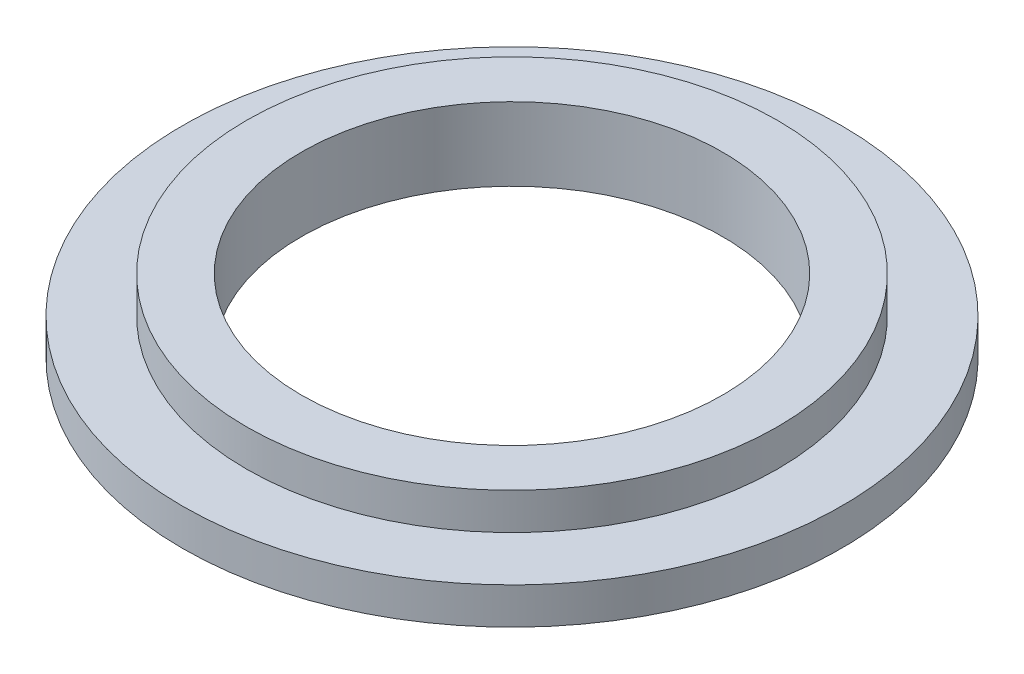
from build123d import *

# Parameters (mm, degrees)
SKETCH1_R               = 18
BOSS_EXTRUDE1_DEPTH     = 2
SKETCH2_R               = 14.5
BOSS_EXTRUDE2_DEPTH     = 2
CUT_EXTRUDE3_DEPTH      = 26.768197453
CUT_EXTRUDE3_DEPTH_BACK = 26.768197453
SKETCH3_R               = 11.5


with BuildPart() as part:
    # Sketch1 → Boss-Extrude1 (new body)
    with BuildSketch(Plane(origin=(0, 0, 0), x_dir=(1, 0, 0), z_dir=(0, 1, 0))):
        Circle(SKETCH1_R)
    extrude(amount=BOSS_EXTRUDE1_DEPTH)

    # Sketch2 → Boss-Extrude2 (add)
    with BuildSketch(Plane(origin=(0, 2, 0), x_dir=(1, 0, 0), z_dir=(0, 1, 0))):
        Circle(SKETCH2_R)
    extrude(amount=BOSS_EXTRUDE2_DEPTH)

    # Sketch3 → Cut-Extrude3 (cut, two sides: drawn at the far end of the back side and taken through both)
    with BuildSketch(Plane(origin=(0, 0, 0), x_dir=(1, 0, 0), z_dir=(0, 1, 0)).offset(-CUT_EXTRUDE3_DEPTH_BACK)):
        Circle(SKETCH3_R)
    extrude(amount=CUT_EXTRUDE3_DEPTH + CUT_EXTRUDE3_DEPTH_BACK, mode=Mode.SUBTRACT)


solid = part.part
